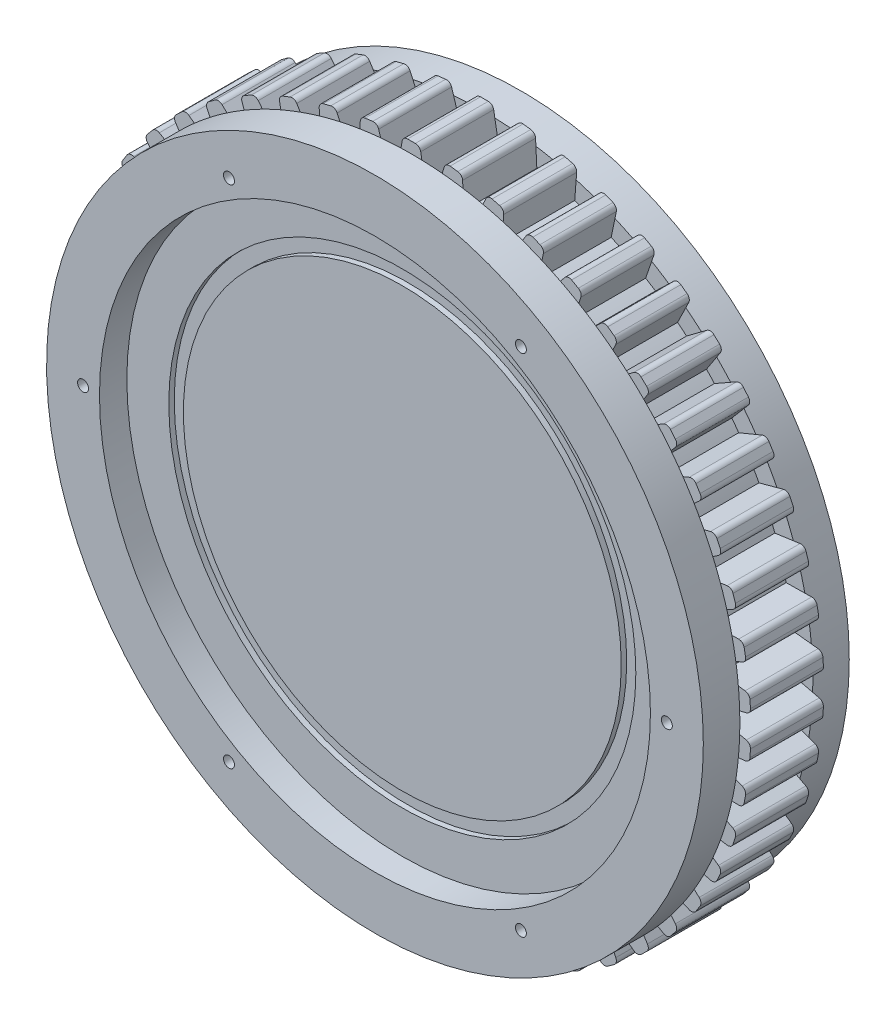
from build123d import *

# Parameters (mm, degrees)
ESQUISSE1_R                        = 90
BOSS_EXTRU_2_DEPTH                 = 40
ESQUISSE2_R                        = 75.5
ENL_V_MAT_EXTRU_1_DEPTH            = 7.5
ESQUISSE3_R                        = 64
ESQUISSE3_R_2                      = 60
ENL_V_MAT_EXTRU_2_DEPTH            = 1.5
COQUE1_OUTLINE_R                   = 80
COQUE1_DEPTH                       = 21
COQUE1_START                       = 21
COQUE1_2_OUTLINE_R                 = 80
COQUE1_2_OUTLINE_R_2               = 74
COQUE1_2_OUTLINE_R_3               = 50
COQUE1_2_DEPTH                     = 1.5
ESQUISSE4_W                        = 20
ESQUISSE4_H                        = 5
ESQUISSE7_R                        = 1.5
ENL_V_MAT_EXTRU_4_DEPTH            = 10
R_P_TITION_CIRCULAIRE2_COUNT       = 6
ESQUISSE8_W                        = 20
ESQUISSE8_H                        = 10
BOSS_EXTRU_3_DEPTH                 = 3.75
ENL_V_MAT_EXTRU_6_DEPTH            = 20
CONG_1_R                           = 1.5
R_P_TITION_CIRCULAIRE3_COUNT       = 50
CONG_1_OF_R_P_TITION_CIRCULAIRE3_R = 1.5
ESQUISSE10_R                       = 6.25
BOSS_EXTRU_4_DEPTH                 = 22.5
ESQUISSE11_R                       = 2.25
ENL_V_MAT_EXTRU_7_DEPTH            = 11.25
SYM_TRIE2_COPY_1_SKETCH_R          = 6.25
SYM_TRIE2_COPY_1_DEPTH             = 22.5
SYM_TRIE2_COPY_2_SKETCH_R          = 2.25
SYM_TRIE2_COPY_2_DEPTH             = 11.25


# Read off the part's stored shape, not the designer's step: Coque1
with BuildPart() as part:
    # Esquisse1 → Boss.-Extru.2 (new body)
    with BuildSketch(Plane.XY):
        Circle(ESQUISSE1_R)
    extrude(amount=BOSS_EXTRU_2_DEPTH)

    # Esquisse2 → Enlèv. mat.-Extru.1 (cut)
    with BuildSketch(Plane.XY.offset(40)):
        Circle(ESQUISSE2_R)
    extrude(amount=-ENL_V_MAT_EXTRU_1_DEPTH, mode=Mode.SUBTRACT)

    # Esquisse3 → Enlèv. mat.-Extru.2 (cut)
    with BuildSketch(Plane.XY.offset(32.5)):
        Circle(ESQUISSE3_R)
        Circle(ESQUISSE3_R_2, mode=Mode.SUBTRACT)
    extrude(amount=-ENL_V_MAT_EXTRU_2_DEPTH, mode=Mode.SUBTRACT)

    # Coque1 outline → Coque1 (cut)
    with BuildSketch(Plane.XY):
        Circle(COQUE1_OUTLINE_R)
    extrude(amount=COQUE1_DEPTH, mode=Mode.SUBTRACT)

    # Coque1 2 outline → Coque1 2 (cut)
    # profile 1 of 2: a face of its own
    with BuildSketch(Plane.XY.offset(COQUE1_START)):
        Circle(COQUE1_2_OUTLINE_R)
        Circle(COQUE1_2_OUTLINE_R_2, mode=Mode.SUBTRACT)
    # profile 2 of 2: a face of its own
    with BuildSketch(Plane.XY.offset(COQUE1_START)):
        Circle(COQUE1_2_OUTLINE_R_3)
    extrude(amount=COQUE1_2_DEPTH, mode=Mode.SUBTRACT)

    # Esquisse4 → Enlèvement de matière-Révolution1 (revolve, cut)
    with BuildSketch(Plane(origin=(0, 0, 0), x_dir=(0, 0, -1), z_dir=(1, 0, 0)), mode=Mode.PRIVATE) as enl_vement_de_mati_re_r_volution1_sk:
        with Locations((-20, -87.5)):
            Rectangle(ESQUISSE4_W, ESQUISSE4_H)
    revolve(enl_vement_de_mati_re_r_volution1_sk.sketch.rotate(Axis((0, 0, 0), (0, 0, 1)), 270), axis=Axis((0, 0, 0), (0, 0, 1)), mode=Mode.SUBTRACT)

    # Esquisse7 → Enlèv. mat.-Extru.4 (cut)
    with BuildSketch(Plane.XY.offset(40)):
        with Locations((80, 0)):
            Circle(ESQUISSE7_R)
    enl_v_mat_extru_4 = extrude(amount=-ENL_V_MAT_EXTRU_4_DEPTH, mode=Mode.SUBTRACT)

    # Répétition circulaire2: Enlèv. mat.-Extru.4 ×6 about axis
    r_p_tition_circulaire2_axis = Axis((0, 0, 0), (0, 0, 1))
    for i in range(1, R_P_TITION_CIRCULAIRE2_COUNT):
        add(enl_v_mat_extru_4.rotate(r_p_tition_circulaire2_axis, i * 360 / R_P_TITION_CIRCULAIRE2_COUNT), mode=Mode.SUBTRACT)

    # Esquisse8 → Boss.-Extru.3 (add, symmetric)
    with BuildSketch(Plane(origin=(0, 0, 0), x_dir=(0, 0, -1), z_dir=(1, 0, 0))):
        with Locations((-20, 88.025747572)):
            Rectangle(ESQUISSE8_W, ESQUISSE8_H)
    boss_extru_3 = extrude(amount=BOSS_EXTRU_3_DEPTH, both=True)

    # Esquisse9 → Enlèv. mat.-Extru.6 (cut)
    with BuildSketch(Plane.XY.offset(30)):
        Polygon((-3.75, 84.917239121), (-2.320251187, 93.025747572), (-3.75, 93.025747572), align=None)
        Polygon((2.320251187, 93.025747572), (3.75, 84.917239121), (3.75, 93.025747572), align=None)
    enl_v_mat_extru_6 = extrude(amount=-ENL_V_MAT_EXTRU_6_DEPTH, mode=Mode.SUBTRACT)

    # Congé1
    cong_1_edges = [part.edges().sort_by_distance(p)[0] for p in [
        (2.320251187, 93.025747572, 20),
        (-2.320251187, 93.025747572, 20),
    ]]
    fillet(cong_1_edges, radius=CONG_1_R)

    # Répétition circulaire3: Boss.-Extru.3, Enlèv. mat.-Extru.6 ×50 about axis
    r_p_tition_circulaire3_axis = Axis((0, 0, 0), (0, 0, 1))
    add([boss_extru_3.rotate(r_p_tition_circulaire3_axis, i * 360 / R_P_TITION_CIRCULAIRE3_COUNT) for i in range(1, R_P_TITION_CIRCULAIRE3_COUNT)])
    add([enl_v_mat_extru_6.rotate(r_p_tition_circulaire3_axis, i * 360 / R_P_TITION_CIRCULAIRE3_COUNT) for i in range(1, R_P_TITION_CIRCULAIRE3_COUNT)], mode=Mode.SUBTRACT)

    # Congé1 of Répétition circulaire3
    cong_1_of_r_p_tition_circulaire3_edges = [part.edges().sort_by_distance(p)[0] for p in [
        (-9.357262435, 92.583016351, 20),
        (-13.961173061, 92.001407183, 20),
        (-20.887206438, 90.680195656, 20),
        (-25.381918896, 89.526149644, 20),
        (-32.087746718, 87.347294105, 20),
        (-36.402376708, 85.639011245, 20),
        (-42.782244065, 82.636873548, 20),
        (-46.848747293, 80.40129448, 20),
        (-52.802039865, 76.62322013, 20),
        (-56.556285148, 73.895601271, 20),
        (-61.989115955, 69.401172758, 20),
        (-65.3718966, 66.224530288, 20),
        (-70.198586655, 61.084627433, 20),
        (-73.156554192, 57.509058901, 20),
        (-77.300983709, 51.804741043, 20),
        (-79.787489223, 47.886635301, 20),
        (-83.184298073, 41.707862941, 20),
        (-85.160127886, 37.509010856, 20),
        (-87.755746364, 30.953226925, 20),
        (-89.18974046, 26.539846904, 20),
        (-90.943234112, 19.71044003, 20),
        (-91.812777547, 15.152133711, 20),
        (-92.696492732, 8.156807721, 20),
        (-92.987872287, 3.525462319, 20),
        (-92.987872287, -3.525462319, 20),
        (-92.696492732, -8.156807721, 20),
        (-91.812777547, -15.152133711, 20),
        (-90.943234112, -19.71044003, 20),
        (-89.18974046, -26.539846904, 20),
        (-87.755746364, -30.953226925, 20),
        (-85.160127886, -37.509010856, 20),
        (-83.184298073, -41.707862941, 20),
        (-79.787489223, -47.886635301, 20),
        (-77.300983709, -51.804741043, 20),
        (-73.156554192, -57.509058901, 20),
        (-70.198586655, -61.084627433, 20),
        (-65.3718966, -66.224530288, 20),
        (-61.989115955, -69.401172758, 20),
        (-56.556285148, -73.895601271, 20),
        (-52.802039865, -76.62322013, 20),
        (-46.848747293, -80.40129448, 20),
        (-42.782244065, -82.636873548, 20),
        (-36.402376708, -85.639011245, 20),
        (-32.087746718, -87.347294105, 20),
        (-25.381918896, -89.526149644, 20),
        (-20.887206438, -90.680195656, 20),
        (-13.961173061, -92.001407183, 20),
        (-9.357262435, -92.583016351, 20),
        (-2.320251187, -93.025747572, 20),
        (2.320251187, -93.025747572, 20),
        (9.357262435, -92.583016351, 20),
        (13.961173061, -92.001407183, 20),
        (20.887206438, -90.680195656, 20),
        (25.381918896, -89.526149644, 20),
        (32.087746718, -87.347294105, 20),
        (36.402376708, -85.639011245, 20),
        (42.782244065, -82.636873548, 20),
        (46.848747293, -80.40129448, 20),
        (52.802039865, -76.62322013, 20),
        (56.556285148, -73.895601271, 20),
        (61.989115955, -69.401172758, 20),
        (65.3718966, -66.224530288, 20),
        (70.198586655, -61.084627433, 20),
        (73.156554192, -57.509058901, 20),
        (77.300983709, -51.804741043, 20),
        (79.787489223, -47.886635301, 20),
        (83.184298073, -41.707862941, 20),
        (85.160127886, -37.509010856, 20),
        (87.755746364, -30.953226925, 20),
        (89.18974046, -26.539846904, 20),
        (90.943234112, -19.71044003, 20),
        (91.812777547, -15.152133711, 20),
        (92.696492732, -8.156807721, 20),
        (92.987872287, -3.525462319, 20),
        (92.987872287, 3.525462319, 20),
        (92.696492732, 8.156807721, 20),
        (91.812777547, 15.152133711, 20),
        (90.943234112, 19.71044003, 20),
        (89.18974046, 26.539846904, 20),
        (87.755746364, 30.953226925, 20),
        (85.160127886, 37.509010856, 20),
        (83.184298073, 41.707862941, 20),
        (79.787489223, 47.886635301, 20),
        (77.300983709, 51.804741043, 20),
        (73.156554192, 57.509058901, 20),
        (70.198586655, 61.084627433, 20),
        (65.3718966, 66.224530288, 20),
        (61.989115955, 69.401172758, 20),
        (56.556285148, 73.895601271, 20),
        (52.802039865, 76.62322013, 20),
        (46.848747293, 80.40129448, 20),
        (42.782244065, 82.636873548, 20),
        (36.402376708, 85.639011245, 20),
        (32.087746718, 87.347294105, 20),
        (25.381918896, 89.526149644, 20),
        (20.887206438, 90.680195656, 20),
        (13.961173061, 92.001407183, 20),
        (9.357262435, 92.583016351, 20),
    ]]
    fillet(cong_1_of_r_p_tition_circulaire3_edges, radius=CONG_1_OF_R_P_TITION_CIRCULAIRE3_R)

    # Esquisse10 → Boss.-Extru.4 (add)
    with BuildSketch(Plane(origin=(0, 0, 22.5), x_dir=(-1, 0, 0), z_dir=(0, 0, -1))):
        with Locations(Location((-22.5, 30, 0), (0, 0, 180))):
            Circle(ESQUISSE10_R)
    boss_extru_4 = extrude(amount=BOSS_EXTRU_4_DEPTH)

    # Esquisse11 → Enlèv. mat.-Extru.7 (cut)
    with BuildSketch(Plane(origin=(0, 0, 0), x_dir=(-1, 0, 0), z_dir=(0, 0, -1))):
        with Locations((-22.5, 30)):
            Circle(ESQUISSE11_R)
    enl_v_mat_extru_7 = extrude(amount=-ENL_V_MAT_EXTRU_7_DEPTH, mode=Mode.SUBTRACT)

    # Symétrie1: Boss.-Extru.4, Enlèv. mat.-Extru.7 across plane
    add(boss_extru_4.mirror(Plane(origin=(0, 0, 0), x_dir=(0, 0, 1), z_dir=(1, 0, 0))))
    add(enl_v_mat_extru_7.mirror(Plane(origin=(0, 0, 0), x_dir=(0, 0, 1), z_dir=(1, 0, 0))), mode=Mode.SUBTRACT)

    # Symétrie2: Boss.-Extru.4, Enlèv. mat.-Extru.7 across plane
    add(boss_extru_4.mirror(Plane.ZX))
    add(enl_v_mat_extru_7.mirror(Plane.ZX), mode=Mode.SUBTRACT)

    # Symétrie2 copy 1 sketch → Symétrie2 copy 1 (add)
    with BuildSketch(Plane(origin=(0, 0, 22.5), x_dir=(1, 0, 0), z_dir=(0, 0, -1))):
        with Locations(Location((-22.5, 30, 0), (0, 0, 180))):
            Circle(SYM_TRIE2_COPY_1_SKETCH_R)
    extrude(amount=SYM_TRIE2_COPY_1_DEPTH)

    # Symétrie2 copy 2 sketch → Symétrie2 copy 2 (cut)
    with BuildSketch(Plane(origin=(0, 0, 0), x_dir=(1, 0, 0), z_dir=(0, 0, -1))):
        with Locations((-22.5, 30)):
            Circle(SYM_TRIE2_COPY_2_SKETCH_R)
    extrude(amount=-SYM_TRIE2_COPY_2_DEPTH, mode=Mode.SUBTRACT)


solid = part.part
